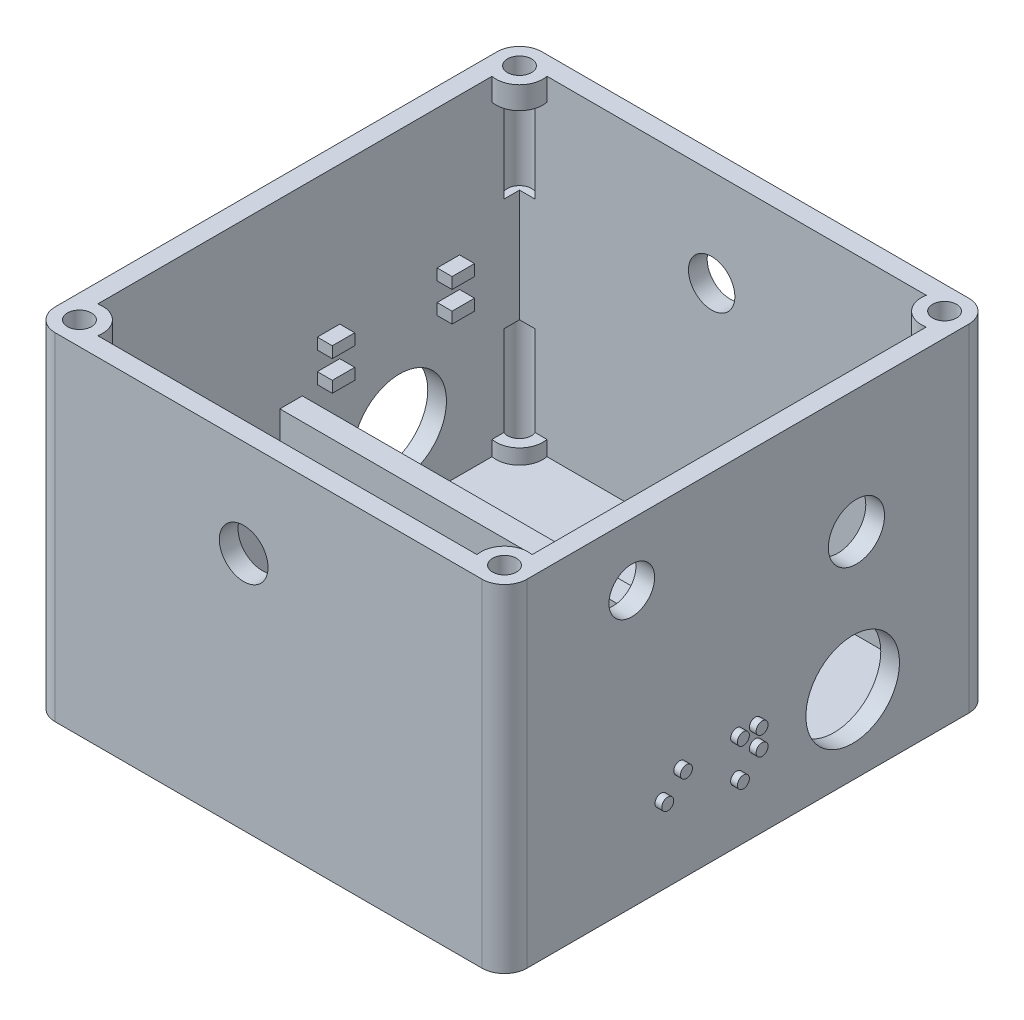
from build123d import *

# Parameters (mm, degrees)
BASE_SKETCH_W                         = 63
BASE_SKETCH_H                         = 65
BASE_SKETCH_W_2                       = 58
BASE_SKETCH_H_2                       = 60
WALLS_DEPTH                           = 45
CLIPS_START                           = 2.5
CLIPS_TOP_OUTLINE_W                   = 1.5
CLIPS_TOP_OUTLINE_H                   = 3
CLIPS_TOP_DEPTH                       = 2
CLIPS_BOTTOM_OUTLINE_W                = 1.5
CLIPS_BOTTOM_OUTLINE_H                = 3
CLIPS_BOTTOM_DEPTH                    = 2
PHONE_START                           = 70
JACK_ENCODER_R                        = 3.05
JACK_ENCODER_R_2                      = 3.75
PHONE_JACK_ENCODER_DEPTH              = 23
FILLET1_R                             = 3
ON_OFF_START                          = -50
ON_OFF_SWITCH_R                       = 3.1
ON_OFF_TOGGLE_SWITCH_HOLE_DEPTH       = 23
BRAILLE_START                         = -65
ON_OFF_SWITCH_7_R                     = 0.8
BRAILLE_ON_OFF_DEPTH                  = 0.9
GUITAR_JACKS_DEPTH                    = 101.140201717
GUITAR_JACKS_DEPTH_BACK               = 101.140201717
GUITAR_PORTS_R                        = 6.25
POTENTIOMETER_HOLE_R                  = 3.25
POTENTIOMETER_DEPTH                   = 10
BASE_SKETCH_11_W                      = 58
BASE_SKETCH_11_H                      = 2.994440775
INNER_WALL_DEPTH                      = 20.7
BASE_SKETCH_12_W                      = 58
BASE_SKETCH_12_H                      = 29.005559225
INNER_WALL_BOTTOM_DEPTH               = 1
HOLES_4_R                             = 1.6
MOUNTING_HOLES_BOTTOM_CUT_DEPTH       = 15
MOUNTING_START                        = 30
HOLES_R                               = 1.6
MOUNTING_HOLES_TOP_CUT_DEPTH          = 15
HOLES_6_R                             = 3.115503651
HOLES_6_R_2                           = 1.6
MOUNTING_HOLES_REINFORCE_BOTTOM_DEPTH = 3
MOUNTING_START_2                      = 42
HOLES_7_R                             = 3.115503651
HOLES_7_R_2                           = 1.6
MOUNTING_HOLES_REINFORCE_TOP_DEPTH    = 3
BRAILLE_EXTRUDE_START                 = 63
BRAILLE_IN_R                          = 0.8
BRAILLE_EXTRUDE_IN_DEPTH              = 0.9
BRAILLE_OUT_R                         = 0.8
BRAILLE_EXTRUDE_OUT_DEPTH             = 0.9


# Read off the part's stored shape, not the designer's step: Clips Top, Clips Bottom
with BuildPart() as part:
    # Base Sketch → Walls (new body)
    with BuildSketch(Plane(origin=(0, 0, 0), x_dir=(1, 0, 0), z_dir=(0, 1, 0))):
        with Locations((31.5, 32.5)):
            Rectangle(BASE_SKETCH_W, BASE_SKETCH_H)
        with Locations((31.5, 32.5)):
            Rectangle(BASE_SKETCH_W_2, BASE_SKETCH_H_2, mode=Mode.SUBTRACT)
    extrude(amount=WALLS_DEPTH)

    # Clips Top outline → Clips Top (add)
    with BuildSketch(Plane.YZ.offset(CLIPS_START)):
        with Locations((25.75, -53)):
            Rectangle(CLIPS_TOP_OUTLINE_W, CLIPS_TOP_OUTLINE_H)
        with Locations((25.75, -37)):
            Rectangle(CLIPS_TOP_OUTLINE_W, CLIPS_TOP_OUTLINE_H)
    extrude(amount=CLIPS_TOP_DEPTH)

    # Clips Bottom outline → Clips Bottom (add)
    with BuildSketch(Plane.YZ.offset(CLIPS_START)):
        with Locations((21.75, -53)):
            Rectangle(CLIPS_BOTTOM_OUTLINE_W, CLIPS_BOTTOM_OUTLINE_H)
        with Locations((21.75, -37)):
            Rectangle(CLIPS_BOTTOM_OUTLINE_W, CLIPS_BOTTOM_OUTLINE_H)
    extrude(amount=CLIPS_BOTTOM_DEPTH)

    # Jack & Encoder → Phone Jack+Encoder (cut)
    with BuildSketch(Plane(origin=(0, 0, 0), x_dir=(0, 0, -1), z_dir=(1, 0, 0)).offset(PHONE_START)):
        with Locations((17, 36.7)):
            Circle(JACK_ENCODER_R)
        with Locations((47, 28.498025774)):
            Circle(JACK_ENCODER_R_2)
    extrude(amount=-PHONE_JACK_ENCODER_DEPTH, mode=Mode.SUBTRACT)

    # Fillet1
    fillet1_edges = [part.edges().sort_by_distance(p)[0] for p in [
        (0, 22.5, 0),
        (0, 22.5, -65),
        (63, 22.5, -65),
        (63, 22.5, 0),
    ]]
    fillet(fillet1_edges, radius=FILLET1_R)

    # On-off Switch → On-off toggle switch hole (cut)
    with BuildSketch(Plane.XY.offset(ON_OFF_START)):
        with Locations((28.164403996, 32.056003541)):
            Circle(ON_OFF_SWITCH_R)
    extrude(amount=-ON_OFF_TOGGLE_SWITCH_HOLE_DEPTH, mode=Mode.SUBTRACT)

    # On-off Switch<7> → Braille On-off (add)
    with BuildSketch(Plane.XY.offset(BRAILLE_START)):
        with Locations((8.064403996, 30.988882574)):
            Circle(ON_OFF_SWITCH_7_R)
        with Locations((8.064403996, 33.488882574)):
            Circle(ON_OFF_SWITCH_7_R)
        with Locations((10.564403996, 28.488882574)):
            Circle(ON_OFF_SWITCH_7_R)
        with Locations((15.664403996, 30.988882574)):
            Circle(ON_OFF_SWITCH_7_R)
        with Locations((18.164403996, 28.488882574)):
            Circle(ON_OFF_SWITCH_7_R)
        with Locations((18.164403996, 33.488882574)):
            Circle(ON_OFF_SWITCH_7_R)
        with Locations((55.864403996, 33.079675966)):
            Circle(ON_OFF_SWITCH_7_R)
        with Locations((38.164403996, 33.079675966)):
            Circle(ON_OFF_SWITCH_7_R)
        with Locations((40.664403996, 33.079675966)):
            Circle(ON_OFF_SWITCH_7_R)
        with Locations((40.664403996, 30.579675966)):
            Circle(ON_OFF_SWITCH_7_R)
        with Locations((45.764403996, 33.079675966)):
            Circle(ON_OFF_SWITCH_7_R)
        with Locations((48.264403996, 33.079675966)):
            Circle(ON_OFF_SWITCH_7_R)
        with Locations((48.264403996, 30.579675966)):
            Circle(ON_OFF_SWITCH_7_R)
        with Locations((55.864403996, 28.079675966)):
            Circle(ON_OFF_SWITCH_7_R)
        with Locations((53.364403996, 30.579675966)):
            Circle(ON_OFF_SWITCH_7_R)
    extrude(amount=-BRAILLE_ON_OFF_DEPTH)

    # Guitar ports → Guitar jacks (cut, two sides: drawn at the far end of the back side and taken through both)
    with BuildSketch(Plane(origin=(2.5, 0, 0), x_dir=(0, 0, -1), z_dir=(1, 0, 0)).offset(-GUITAR_JACKS_DEPTH_BACK)):
        with Locations((46.5, 10.5)):
            Circle(GUITAR_PORTS_R)
    extrude(amount=GUITAR_JACKS_DEPTH + GUITAR_JACKS_DEPTH_BACK, mode=Mode.SUBTRACT)

    # Potentiometer hole → Potentiometer (cut)
    with BuildSketch(Plane.XY):
        with Locations((28.164403996, 32.056003541)):
            Circle(POTENTIOMETER_HOLE_R)
    extrude(amount=-POTENTIOMETER_DEPTH, mode=Mode.SUBTRACT)

    # Base Sketch<11> → Inner-wall (add)
    with BuildSketch(Plane(origin=(0, 0, 0), x_dir=(1, 0, 0), z_dir=(0, 1, 0))):
        with Locations((31.5, 31.997220388)):
            Rectangle(BASE_SKETCH_11_W, BASE_SKETCH_11_H)
    extrude(amount=INNER_WALL_DEPTH)

    # Base Sketch<12> → Inner-wall bottom (add)
    with BuildSketch(Plane(origin=(0, 0, 0), x_dir=(1, 0, 0), z_dir=(0, 1, 0))):
        with Locations((31.5, 47.997220388)):
            Rectangle(BASE_SKETCH_12_W, BASE_SKETCH_12_H)
    extrude(amount=INNER_WALL_BOTTOM_DEPTH)

    # Holes<4> → Mounting Holes Bottom Cut (cut)
    with BuildSketch(Plane(origin=(0, 0, 0), x_dir=(1, 0, 0), z_dir=(0, 1, 0))):
        with Locations(Location((59.884496349, 61.884496349, 0), (0, 0, 157.375517099))):
            Circle(HOLES_4_R)
        with Locations(Location((3.115503651, 61.884496349, 0), (0, 0, 22.624482901))):
            Circle(HOLES_4_R)
        with Locations((3.115503651, 3.115503651)):
            Circle(HOLES_4_R)
        with Locations((59.884496349, 3.115503651)):
            Circle(HOLES_4_R)
    extrude(amount=MOUNTING_HOLES_BOTTOM_CUT_DEPTH, mode=Mode.SUBTRACT)

    # Holes → Mounting Holes Top Cut (cut)
    with BuildSketch(Plane(origin=(0, 0, 0), x_dir=(1, 0, 0), z_dir=(0, 1, 0)).offset(MOUNTING_START)):
        with Locations(Location((3.115503651, 61.884496349, 0), (0, 0, 22.624482901))):
            Circle(HOLES_R)
        with Locations(Location((59.884496349, 61.884496349, 0), (0, 0, 157.375517099))):
            Circle(HOLES_R)
        with Locations((59.884496349, 3.115503651)):
            Circle(HOLES_R)
        with Locations((3.115503651, 3.115503651)):
            Circle(HOLES_R)
    extrude(amount=MOUNTING_HOLES_TOP_CUT_DEPTH, mode=Mode.SUBTRACT)

    # Holes<6> → Mounting Holes Reinforce Bottom (add)
    # profile 1 of 4: a face of its own
    with BuildSketch(Plane(origin=(0, 0, 0), x_dir=(1, 0, 0), z_dir=(0, 1, 0))):
        with Locations((3.115503651, 3.115503651)):
            Circle(HOLES_6_R)
        with Locations(Location((3.115503651, 3.115503651, 0), (0, 0, 112.624482901))):
            Circle(HOLES_6_R_2, mode=Mode.SUBTRACT)
    # profile 2 of 4: a face of its own
    with BuildSketch(Plane(origin=(0, 0, 0), x_dir=(1, 0, 0), z_dir=(0, 1, 0))):
        with Locations((59.884496349, 3.115503651)):
            Circle(HOLES_6_R)
        with Locations(Location((59.884496349, 3.115503651, 0), (0, 0, 67.375517099))):
            Circle(HOLES_6_R_2, mode=Mode.SUBTRACT)
    # profile 3 of 4: a face of its own
    with BuildSketch(Plane(origin=(0, 0, 0), x_dir=(1, 0, 0), z_dir=(0, 1, 0))):
        with Locations((59.884496349, 61.884496349)):
            Circle(HOLES_6_R)
        with Locations(Location((59.884496349, 61.884496349, 0), (0, 0, 157.375517099))):
            Circle(HOLES_6_R_2, mode=Mode.SUBTRACT)
    # profile 4 of 4: a face of its own
    with BuildSketch(Plane(origin=(0, 0, 0), x_dir=(1, 0, 0), z_dir=(0, 1, 0))):
        with Locations((3.115503651, 61.884496349)):
            Circle(HOLES_6_R)
        with Locations(Location((3.115503651, 61.884496349, 0), (0, 0, 22.624482901))):
            Circle(HOLES_6_R_2, mode=Mode.SUBTRACT)
    extrude(amount=MOUNTING_HOLES_REINFORCE_BOTTOM_DEPTH)

    # Holes<7> → Mounting Holes Reinforce Top (add)
    # profile 1 of 4: a face of its own
    with BuildSketch(Plane(origin=(0, 0, 0), x_dir=(1, 0, 0), z_dir=(0, 1, 0)).offset(MOUNTING_START_2)):
        with Locations((3.115503651, 3.115503651)):
            Circle(HOLES_7_R)
        with Locations(Location((3.115503651, 3.115503651, 0), (0, 0, 112.624482901))):
            Circle(HOLES_7_R_2, mode=Mode.SUBTRACT)
    # profile 2 of 4: a face of its own
    with BuildSketch(Plane(origin=(0, 0, 0), x_dir=(1, 0, 0), z_dir=(0, 1, 0)).offset(MOUNTING_START_2)):
        with Locations((59.884496349, 3.115503651)):
            Circle(HOLES_7_R)
        with Locations(Location((59.884496349, 3.115503651, 0), (0, 0, 67.375517099))):
            Circle(HOLES_7_R_2, mode=Mode.SUBTRACT)
    # profile 3 of 4: a face of its own
    with BuildSketch(Plane(origin=(0, 0, 0), x_dir=(1, 0, 0), z_dir=(0, 1, 0)).offset(MOUNTING_START_2)):
        with Locations((59.884496349, 61.884496349)):
            Circle(HOLES_7_R)
        with Locations(Location((59.884496349, 61.884496349, 0), (0, 0, 157.375517099))):
            Circle(HOLES_7_R_2, mode=Mode.SUBTRACT)
    # profile 4 of 4: a face of its own
    with BuildSketch(Plane(origin=(0, 0, 0), x_dir=(1, 0, 0), z_dir=(0, 1, 0)).offset(MOUNTING_START_2)):
        with Locations((3.115503651, 61.884496349)):
            Circle(HOLES_7_R)
        with Locations(Location((3.115503651, 61.884496349, 0), (0, 0, 22.624482901))):
            Circle(HOLES_7_R_2, mode=Mode.SUBTRACT)
    extrude(amount=MOUNTING_HOLES_REINFORCE_TOP_DEPTH)

    # Braille In → Braille-extrude In (add)
    with BuildSketch(Plane(origin=(0, 0, 0), x_dir=(0, 0, -1), z_dir=(1, 0, 0)).offset(BRAILLE_EXTRUDE_START)):
        with Locations(Location((20.9, 10.5, 0), (0, 0, 180))):
            Circle(BRAILLE_IN_R)
        with Locations(Location((23.4, 13, 0), (0, 0, 180))):
            Circle(BRAILLE_IN_R)
        with Locations(Location((31, 13, 0), (0, 0, 180))):
            Circle(BRAILLE_IN_R)
        with Locations(Location((33.5, 10.5, 0), (0, 0, 180))):
            Circle(BRAILLE_IN_R)
        with Locations(Location((33.5, 13, 0), (0, 0, 180))):
            Circle(BRAILLE_IN_R)
        with Locations(Location((31, 8, 0), (0, 0, 180))):
            Circle(BRAILLE_IN_R)
    extrude(amount=BRAILLE_EXTRUDE_IN_DEPTH)

    # Braille Out → Braille-extrude Out (add)
    with BuildSketch(Plane(origin=(0, 0, 0), x_dir=(0, 0, -1), z_dir=(1, 0, 0))):
        with Locations((17.3, 13)):
            Circle(BRAILLE_OUT_R)
        with Locations((17.3, 10.5)):
            Circle(BRAILLE_OUT_R)
        with Locations((19.8, 10.5)):
            Circle(BRAILLE_OUT_R)
        with Locations((19.8, 8)):
            Circle(BRAILLE_OUT_R)
        with Locations((24.9, 8)):
            Circle(BRAILLE_OUT_R)
        with Locations((27.4, 8)):
            Circle(BRAILLE_OUT_R)
        with Locations((27.4, 13)):
            Circle(BRAILLE_OUT_R)
        with Locations((32.5, 10.5)):
            Circle(BRAILLE_OUT_R)
        with Locations((35, 13)):
            Circle(BRAILLE_OUT_R)
        with Locations((35, 8)):
            Circle(BRAILLE_OUT_R)
    extrude(amount=-BRAILLE_EXTRUDE_OUT_DEPTH)


solid = part.part
